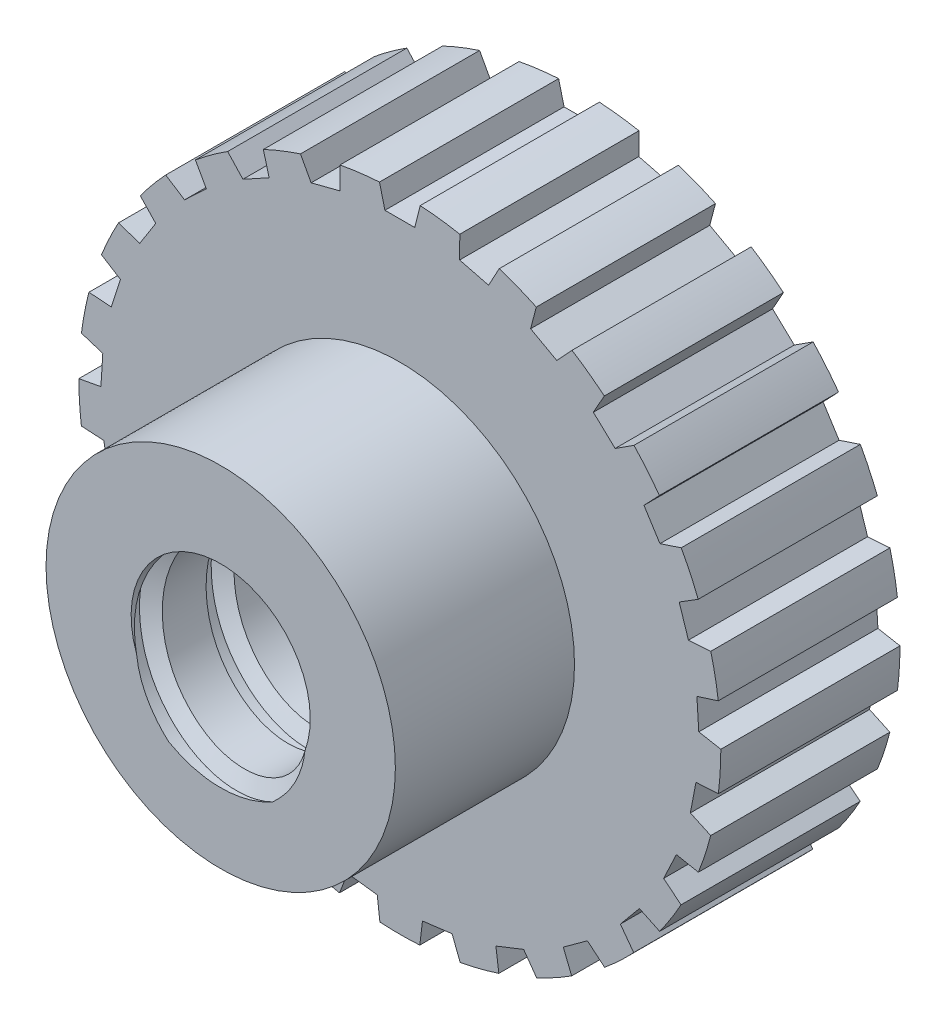
from build123d import *

# Parameters (mm, degrees)
SKETCH1_R           = 5.375
BOSS_EXTRUDE2_DEPTH = 3
SKETCH3_R           = 2.925
BOSS_EXTRUDE3_DEPTH = 3
SKETCH4_R           = 1.5
CUT_EXTRUDE1_DEPTH  = 8
CUT_EXTRUDE2_DEPTH  = 3
CUT_SWEEP1_PITCH    = 1.2


with BuildPart() as part:
    # Sketch1 → Boss-Extrude2 (new body)
    with BuildSketch(Plane.XY):
        Circle(SKETCH1_R)
    extrude(amount=BOSS_EXTRUDE2_DEPTH)

    # Sketch3 → Boss-Extrude3 (add)
    with BuildSketch(Plane.XY.offset(3)):
        Circle(SKETCH3_R)
    extrude(amount=BOSS_EXTRUDE3_DEPTH)

    # Sketch4 → Cut-Extrude1 (cut)
    with BuildSketch(Plane.XY.offset(6)):
        Circle(SKETCH4_R)
    extrude(amount=-CUT_EXTRUDE1_DEPTH, mode=Mode.SUBTRACT)

    # Sketch5 → Cut-Extrude2 (cut)
    with BuildSketch(Plane.XY.offset(3)):
        Polygon((-0.5, 6), (0.5, 6), (0.25, 5), (-0.25, 5), align=None)
        Polygon((1.976430904, 5.687154023), (1.485595226, 4.780743334), (1.001303646, 4.905088277), (1.007847742, 5.93584391), align=None)
        Polygon((3.328675385, 5.016963243), (2.627845041, 4.261094982), (2.1896917, 4.501971819), (2.452368705, 5.498716917), align=None)
        Polygon((4.471766949, 4.031538212), (3.604977686, 3.473706361), (3.240493373, 3.815979914), (3.742798322, 4.716085317), align=None)
        Polygon((5.333880951, 2.792796807), (4.355596326, 2.468051994), (4.087682929, 2.890215956), (4.798054156, 3.637124733), align=None)
        Polygon((5.860847595, 1.378573708), (4.83253683, 1.307320843), (4.678028333, 1.782849101), (5.551830601, 2.329630224), align=None)
        Polygon((6.01955563, -0.122270247), (5.005831272, 0.064445916), (4.974436012, 0.56345928), (5.956765111, 0.875756481), align=None)
        Polygon((5.800032847, -1.615431513), (4.864590925, -1.182478386), (4.958281582, -0.69133476), (5.987414162, -0.633144262), align=None)
        Polygon((5.216072669, -3.007089276), (4.417690439, -2.355103221), (4.630580085, -1.902689695), (5.641851961, -2.102262223), align=None)
        Polygon((4.304367462, -4.20980056), (3.693210216, -3.379748259), (4.011922211, -2.994491638), (4.941791452, -3.439287317), align=None)
        Polygon((3.122203017, -5.147994592), (2.736672013, -4.192031285), (3.14118051, -3.898138659), (3.931220011, -4.56020934), align=None)
        Polygon((1.743859073, -5.762721192), (1.608178642, -4.740913568), (2.073066885, -4.556851291), (2.673635559, -5.394596639), align=None)
        Polygon((0.255942051, -6.015354825), (0.378637492, -4.991906815), (0.874694843, -4.929240198), (1.248056752, -5.890021591), align=None)
        Polygon((-1.248056752, -5.890021591), (-0.874694843, -4.929240198), (-0.378637492, -4.991906815), (-0.255942051, -6.015354825), align=None)
        Polygon((-2.673635559, -5.394596639), (-2.073066885, -4.556851291), (-1.608178642, -4.740913568), (-1.743859073, -5.762721192), align=None)
        Polygon((-3.931220011, -4.56020934), (-3.14118051, -3.898138659), (-2.736672013, -4.192031285), (-3.122203017, -5.147994592), align=None)
        Polygon((-4.941791452, -3.439287317), (-4.011922211, -2.994491638), (-3.693210216, -3.379748259), (-4.304367462, -4.20980056), align=None)
        Polygon((-5.641851961, -2.102262223), (-4.630580085, -1.902689695), (-4.417690439, -2.355103221), (-5.216072669, -3.007089276), align=None)
        Polygon((-5.987414162, -0.633144262), (-4.958281582, -0.69133476), (-4.864590925, -1.182478386), (-5.800032847, -1.615431513), align=None)
        Polygon((-5.956765111, 0.875756481), (-4.974436012, 0.56345928), (-5.005831272, 0.064445916), (-6.01955563, -0.122270247), align=None)
        Polygon((-5.551830601, 2.329630224), (-4.678028333, 1.782849101), (-4.83253683, 1.307320843), (-5.860847595, 1.378573708), align=None)
        Polygon((-4.798054156, 3.637124733), (-4.087682929, 2.890215956), (-4.355596326, 2.468051994), (-5.333880951, 2.792796807), align=None)
        Polygon((-3.742798322, 4.716085317), (-3.240493373, 3.815979914), (-3.604977686, 3.473706361), (-4.471766949, 4.031538212), align=None)
        Polygon((-2.452368705, 5.498716917), (-2.1896917, 4.501971819), (-2.627845041, 4.261094982), (-3.328675385, 5.016963243), align=None)
        Polygon((-1.007847742, 5.93584391), (-1.001303646, 4.905088277), (-1.485595226, 4.780743334), (-1.976430904, 5.687154023), align=None)
    extrude(amount=-CUT_EXTRUDE2_DEPTH, mode=Mode.SUBTRACT)

    # Cut-Sweep1: arcs per turn and ends read off the stored shape
    # Cut-Sweep1: the profile of Sketch6 screwed along a right-hand helix through 8 turns, 8 arcs to a turn; built about Z, then put on its axis
    cut_sweep1_z = Axis((0, 0, 0), (0, 0, 1))
    cut_sweep1_corners = [(1, 1.75e-07, -1.399999967), (1, 1.75e-07, -0.399999967), (1.75, 3.05e-07, -0.799999967), (1.75, 3.05e-07, -0.999999967)]
    with BuildLine(mode=Mode.PRIVATE) as cut_sweep1_profile:
        Line(cut_sweep1_corners[0], cut_sweep1_corners[1])
        Line(cut_sweep1_corners[1], cut_sweep1_corners[2])
        Line(cut_sweep1_corners[2], cut_sweep1_corners[3])
        Line(cut_sweep1_corners[3], cut_sweep1_corners[0])
    cut_sweep1_cap = Face(cut_sweep1_profile.wire())
    cut_sweep1_turn_angles = [0, 22.5, 45, 67.5, 90, 112.5, 135, 157.5, 180, 202.5, 225, 247.5, 270, 292.5, 315, 337.5, 360]
    cut_sweep1_turn_weights = [1, 0.9238795325112867, 1, 0.9238795325112867, 1, 0.9238795325112867, 1, 0.9238795325112867, 1, 0.9238795325112867, 1, 0.9238795325112867, 1, 0.9238795325112867, 1, 0.9238795325112867, 1]
    cut_sweep1_turn_rails = [Edge.make_bspline([Vector(p[0], p[1], 0).rotate(cut_sweep1_z, cut_sweep1_turn_angles[k]) / cut_sweep1_turn_weights[k] + Vector(0, 0, p[2] + CUT_SWEEP1_PITCH * cut_sweep1_turn_angles[k] / 360) for k in range(17)], [0, 0, 0, 1, 1, 2, 2, 3, 3, 4, 4, 5, 5, 6, 6, 7, 7, 8, 8, 8], 2, cut_sweep1_turn_weights) for p in cut_sweep1_corners]
    cut_sweep1_turn_sides = [Face.make_surface_from_curves(cut_sweep1_turn_rails[p[0]], cut_sweep1_turn_rails[p[1]]) for p in [(0, 1), (1, 2), (2, 3), (3, 0)]]
    cut_sweep1 = Plane(origin=(0, 0, 0), x_dir=(1, 0, 0), z_dir=(0, 0, 1)) * Solid(Shell([*[p.moved(Location((0, 0, CUT_SWEEP1_PITCH * i))) for i in range(8) for p in cut_sweep1_turn_sides], cut_sweep1_cap, cut_sweep1_cap.rotate(cut_sweep1_z, 2880).moved(Location((0, 0, CUT_SWEEP1_PITCH * 2880 / 360)))]))
    add(cut_sweep1, mode=Mode.SUBTRACT)


solid = part.part
